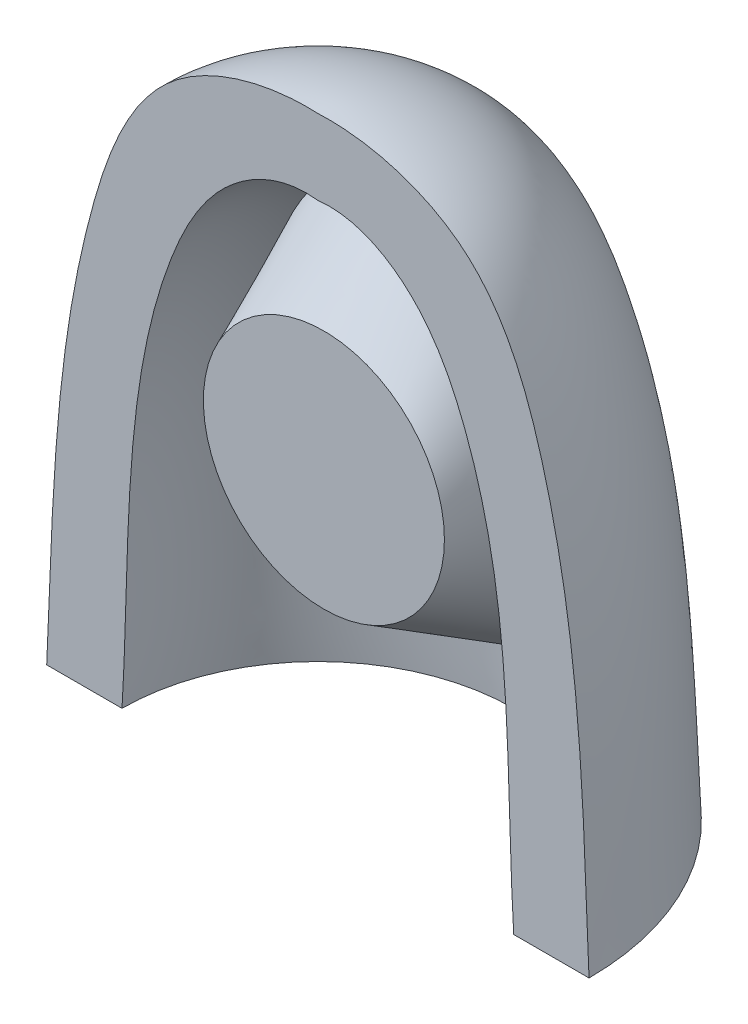
from build123d import *

# Parameters (mm, degrees)
SKETCH2_W          = 21.920038039
SKETCH2_H          = 22.914873095
CUT_EXTRUDE1_DEPTH = 9


with BuildPart() as part:
    # Sketch1 → Revolve1 (revolve)
    with BuildSketch(Plane.XY):
        with BuildLine():
            Line((6.5, 0), (9, 0))
            add(Edge.make_bspline(
                [(0, 20.35), (1.675966842, 20.428176516), (5.66035993, 19.372470149), (8.740520085, 10.941984052), (8.794057121, 4.785623995), (9, 0)],
                knots=[0, 0, 0, 0, 0.209086974, 0.440428739, 1, 1, 1, 1], degree=3))
            Line((0, 20.35), (0, 17.85))
            add(Edge.make_bspline(
                [(0, 17.85), (1.248468613, 18.003104069), (3.434295374, 16.83334968), (6.617297319, 10.514055415), (6.220398856, 4.532307189), (6.5, 0)],
                knots=[0, 0, 0, 0, 0.174730572, 0.328981961, 1, 1, 1, 1], degree=3))
        make_face()
    revolve(axis=Axis((0, 24.080193906, 0), (0, -1, 0)))

    # Sketch2 → Cut-Extrude1 (cut)
    with BuildSketch(Plane.XY.offset(9)):
        with Locations((-0.139254467, 10.620448961)):
            Rectangle(SKETCH2_W, SKETCH2_H)
    extrude(amount=-CUT_EXTRUDE1_DEPTH, mode=Mode.SUBTRACT)

    # Loft1: read off the stored shape, not the designer's step
    # Loft1: loft between two sections, ruled curve by curve
    loft1_from = [
        Edge.make_bspline([(0, 1.344428361, -7.62463212), (10.784005956, 1.344428361, -7.62463212), (10.784005956, 18.932107275, -4.523449799), (0, 18.932107275, -4.523449799), (-10.784005956, 18.932107275, -4.523449799), (-10.784005956, 1.344428361, -7.62463212), (0, 1.344428361, -7.62463212)], [0, 0, 0, 0, 0.5, 0.5, 0.5, 1, 1, 1, 1], 3, [1, 0.333333333, 0.333333333, 1, 0.333333333, 0.333333333, 1]),
    ]
    loft1_to = [
        Edge.make_bspline([(0.012725843, 6.000020243, -0.2), (8.012685357, 6.02547193, -0.2), (7.98723367, 14.025431443, -0.2), (-0.012725843, 13.999979757, -0.2), (-8.012685357, 13.97452807, -0.2), (-7.98723367, 5.974568557, -0.2), (0.012725843, 6.000020243, -0.2)], [0, 0, 0, 0, 0.5, 0.5, 0.5, 1, 1, 1, 1], 3, [1, 0.333333333, 0.333333333, 1, 0.333333333, 0.333333333, 1]),
    ]
    loft1 = Solid(Shell([*[Face.make_surface_from_curves(loft1_from[k], loft1_to[k]) for k in range(1)], Face(Wire(loft1_from)), Face(Wire(loft1_to))]))
    add(loft1)


solid = part.part
